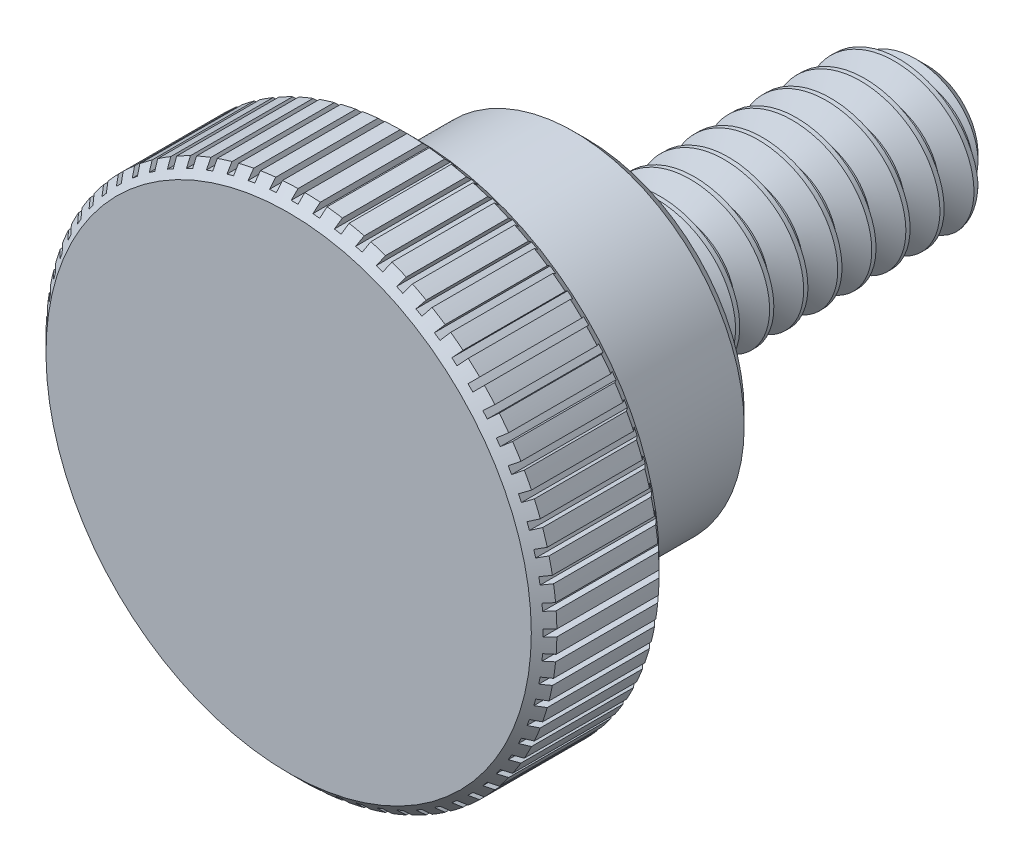
from build123d import *

# Parameters (mm, degrees)
SKETCH1_R               = 1.4224
EXTRUDE1_DEPTH          = 6.35
CHAMFER2_SIZE           = 0.47625
CUT_SWEEP1_PITCH        = 0.635
SKETCH27_R              = 3.175
BOSS_EXTRUDE4_DEPTH     = 3.175
SKETCH21_R              = 4.7625
BOSS_EXTRUDE1_DEPTH     = 2.38125
CHAMFER3_SIZE           = 0.238125
FILLET1_R               = 0.238125
CUT_EXTRUDE1_REACH      = 14.399
CUT_EXTRUDE1_END_RADIUS = 4.7625
SKETCH22_W              = 0.127
SKETCH22_H              = 2.38125
CIRPATTERN1_COUNT       = 72


with BuildPart() as part:
    # Sketch1 → Extrude1 (new body)
    with BuildSketch(Plane.XY):
        Circle(SKETCH1_R)
    extrude(amount=-EXTRUDE1_DEPTH)

    # Chamfer2
    chamfer2_edges = [part.edges().sort_by_distance(p)[0] for p in [
        (-1.4224, 0, -6.35),
    ]]
    chamfer(chamfer2_edges, length=CHAMFER2_SIZE)

    # Cut-Sweep1: the profile of Sketch14 profile screwed along a right-hand helix of 11 turns, 6 arcs to a turn; built about Z, then put on its axis
    cut_sweep1_z = Axis((0, 0, 0), (0, 0, 1))
    cut_sweep1_corners = [(1.4227, 0, 0.000173205), (1.4227, 0, -0.555798205), (1.009955401, 0, -0.3175), (1.009955401, 0, -0.238125)]
    with BuildLine(mode=Mode.PRIVATE) as cut_sweep1_profile:
        Line(cut_sweep1_corners[0], cut_sweep1_corners[1])
        Line(cut_sweep1_corners[1], cut_sweep1_corners[2])
        Line(cut_sweep1_corners[2], cut_sweep1_corners[3])
        Line(cut_sweep1_corners[3], cut_sweep1_corners[0])
    cut_sweep1_cap = Face(cut_sweep1_profile.wire())
    cut_sweep1_turn_angles = [0, 30, 60, 90, 120, 150, 180, 210, 240, 270, 300, 330, 360]
    cut_sweep1_turn_weights = [1, 0.8660254037844387, 1, 0.8660254037844387, 1, 0.8660254037844387, 1, 0.8660254037844387, 1, 0.8660254037844387, 1, 0.8660254037844387, 1]
    cut_sweep1_turn_rails = [Edge.make_bspline([Vector(p[0], p[1], 0).rotate(cut_sweep1_z, cut_sweep1_turn_angles[k]) / cut_sweep1_turn_weights[k] + Vector(0, 0, p[2] + CUT_SWEEP1_PITCH * cut_sweep1_turn_angles[k] / 360) for k in range(13)], [0, 0, 0, 1, 1, 2, 2, 3, 3, 4, 4, 5, 5, 6, 6, 6], 2, cut_sweep1_turn_weights) for p in cut_sweep1_corners]
    cut_sweep1_turn_sides = [Face.make_surface_from_curves(cut_sweep1_turn_rails[p[0]], cut_sweep1_turn_rails[p[1]]) for p in [(0, 1), (1, 2), (2, 3), (3, 0)]]
    cut_sweep1 = Plane(origin=(0, 0, -6.35), x_dir=(0, 1, 0), z_dir=(0, 0, 1)) * Solid(Shell([*[p.moved(Location((0, 0, CUT_SWEEP1_PITCH * i))) for i in range(11) for p in cut_sweep1_turn_sides], cut_sweep1_cap, cut_sweep1_cap.rotate(cut_sweep1_z, 3960).moved(Location((0, 0, CUT_SWEEP1_PITCH * 3960 / 360)))]))
    add(cut_sweep1, mode=Mode.SUBTRACT)

    # Sketch27 → Boss-Extrude4 (add)
    with BuildSketch(Plane.XY):
        Circle(SKETCH27_R)
    extrude(amount=BOSS_EXTRUDE4_DEPTH)

    # Sketch21 → Boss-Extrude1 (add)
    with BuildSketch(Plane.XY.offset(3.175)):
        with Locations(Location((0, 0, 0), (0, 0, 180))):
            Circle(SKETCH21_R)
    extrude(amount=BOSS_EXTRUDE1_DEPTH)

    # Chamfer3
    chamfer3_edges = [part.edges().sort_by_distance(p)[0] for p in [
        (-3.175, 0, 0),
        (4.7625, 0, 3.175),
        (4.7625, 0, 5.55625),
    ]]
    chamfer(chamfer3_edges, length=CHAMFER3_SIZE)

    # Fillet1
    fillet1_edges = [part.edges().sort_by_distance(p)[0] for p in [
        (-3.175, 0, 3.175),
    ]]
    fillet(fillet1_edges, radius=FILLET1_R)

    # Cut-Extrude1: up to this cylinder (the profile starts outside it)
    cut_extrude1_end = Plane(origin=(0, -0.127, 4.365625), z_dir=(0, 0, -1)) * Cylinder(CUT_EXTRUDE1_END_RADIUS, 39.323, mode=Mode.PRIVATE)
    # Sketch22 → Cut-Extrude1 (cut, up to the surface)
    with BuildSketch(Plane(origin=(0, 4.7625, 0), x_dir=(-1, 0, 0), z_dir=(0, 1, 0)), mode=Mode.PRIVATE) as cut_extrude1_sk1:
        with Locations((0, 4.365625)):
            Rectangle(SKETCH22_W, SKETCH22_H)
    cut_extrude1_tool1 = extrude(cut_extrude1_sk1.sketch, amount=-CUT_EXTRUDE1_REACH, mode=Mode.PRIVATE) - cut_extrude1_end
    cut_extrude1 = cut_extrude1_tool1.solids().sort_by_distance((0, 4.7625, 4.365625))[0]
    add(cut_extrude1, mode=Mode.SUBTRACT)

    # CirPattern1: Cut-Extrude1 ×72 about axis
    cirpattern1_axis = Axis((0, 0, 0), (0, 0, 1))
    for i in range(1, CIRPATTERN1_COUNT):
        add(cut_extrude1.rotate(cirpattern1_axis, i * 360 / CIRPATTERN1_COUNT), mode=Mode.SUBTRACT)


solid = part.part
